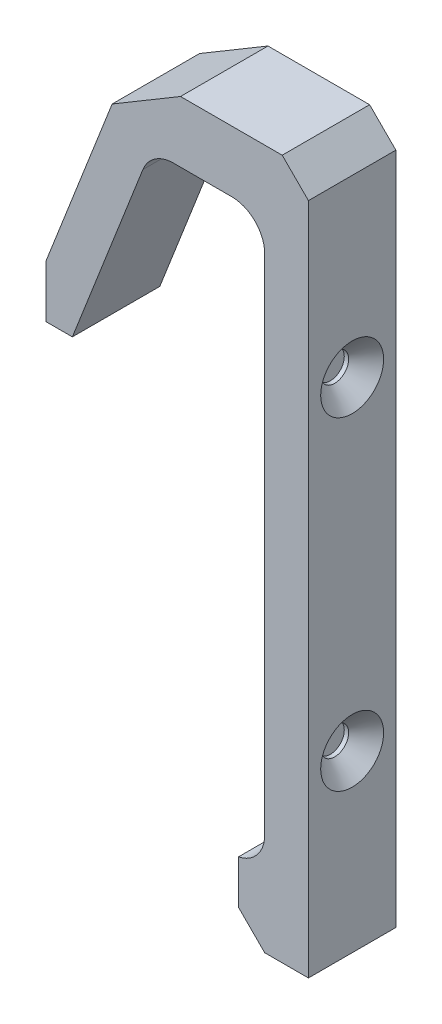
from build123d import *

# Parameters (mm, degrees)
SKETCH1_W           = 76.2
SKETCH1_H           = 203.2
BOSS_EXTRUDE1_DEPTH = 25.4
CUT_EXTRUDE1_DEPTH  = 219.499061783
FILLET1_R           = 9.525
CHAMFER3_SIZE       = 7.62
CHAMFER5_SIZE       = 12.7
CHAMFER5_SIZE2      = 15.24
SKETCH5_R           = 4.064
CUT_EXTRUDE2_DEPTH  = 6.35
CHAMFER6_SIZE       = 5.08
FILLET2_R           = 9.525
CHAMFER7_SIZE       = 7.62


with BuildPart() as part:
    # Sketch1 → Boss-Extrude1 (new body)
    with BuildSketch(Plane.XY):
        with Locations((38.1, 101.6)):
            Rectangle(SKETCH1_W, SKETCH1_H)
    extrude(amount=BOSS_EXTRUDE1_DEPTH)

    # Sketch2 → Cut-Extrude1 (cut, through all)
    with BuildSketch(Plane.XY.offset(25.4)):
        Polygon((0, 0), (55.88, 0), (55.88, 20.32), (63.5, 20.32), (63.5, 185.42), (30.48, 185.42), (7.62, 127), (0, 127), align=None)
        Polygon((0, 142.378540166), (23.799701674, 203.2), (0, 203.2), align=None)
    extrude(amount=-CUT_EXTRUDE1_DEPTH, mode=Mode.SUBTRACT)

    # Fillet1
    fillet1_edges = [part.edges().sort_by_distance(p)[0] for p in [
        (30.48, 185.42, 12.7),
        (63.5, 185.42, 12.7),
    ]]
    fillet(fillet1_edges, radius=FILLET1_R)

    # Chamfer3
    chamfer3_edges = [part.edges().sort_by_distance(p)[0] for p in [
        (76.2, 203.2, 12.7),
    ]]
    chamfer(chamfer3_edges, length=CHAMFER3_SIZE)

    # Chamfer5
    chamfer5_edges = [part.edges().sort_by_distance(p)[0] for p in [
        (23.799701674, 203.2, 12.7),
    ]]
    chamfer5_side = [part.faces().sort_by_distance(p)[0] for p in [
        (11.899850837, 172.789270083, 12.7),
    ]]
    chamfer(chamfer5_edges, length=CHAMFER5_SIZE, length2=CHAMFER5_SIZE2, reference=chamfer5_side[0])

    # Sketch5 → Cut-Extrude2 (cut)
    with BuildSketch(Plane(origin=(76.2, 0, 0), x_dir=(0, 0, -1), z_dir=(1, 0, 0))):
        with Locations((-12.7, 144.78)):
            Circle(SKETCH5_R)
        with Locations((-12.7, 50.8)):
            Circle(SKETCH5_R)
    extrude(amount=-CUT_EXTRUDE2_DEPTH, mode=Mode.SUBTRACT)

    # Chamfer6
    chamfer6_edges = [part.edges().sort_by_distance(p)[0] for p in [
        (76.2, 144.78, 16.764),
        (76.2, 50.8, 16.764),
    ]]
    chamfer(chamfer6_edges, length=CHAMFER6_SIZE)

    # Fillet2
    # the kernel refuses this fillet: 9.525 mm, written as the material it adds along each edge
    with BuildSketch(Plane(origin=(63.5, 20.32, 25.4), x_dir=(-1, 0, 0), z_dir=(0, 0, -1))) as fillet2_piece_1:
        with BuildLine():
            CenterArc((9.525, 9.33255592), FILLET2_R, 180, 78.463040967)
            Line((0, 9.33255592), (-0.1905, 9.33255592))
            Line((-0.1905, 9.33255592), (-0.1905, 0))
            Line((-0.1905, 0), (0, -0.1905))
            ThreePointArc((0, -0.1905), (3.81, -0.1905), (7.5819, -0.186651118))
            Line((7.5819, -0.186651118), (7.62, 0))
        make_face()
    extrude(amount=25.4)

    # Chamfer7
    chamfer7_edges = [part.edges().sort_by_distance(p)[0] for p in [
        (55.88, 0, 12.7),
    ]]
    chamfer(chamfer7_edges, length=CHAMFER7_SIZE)


solid = part.part
